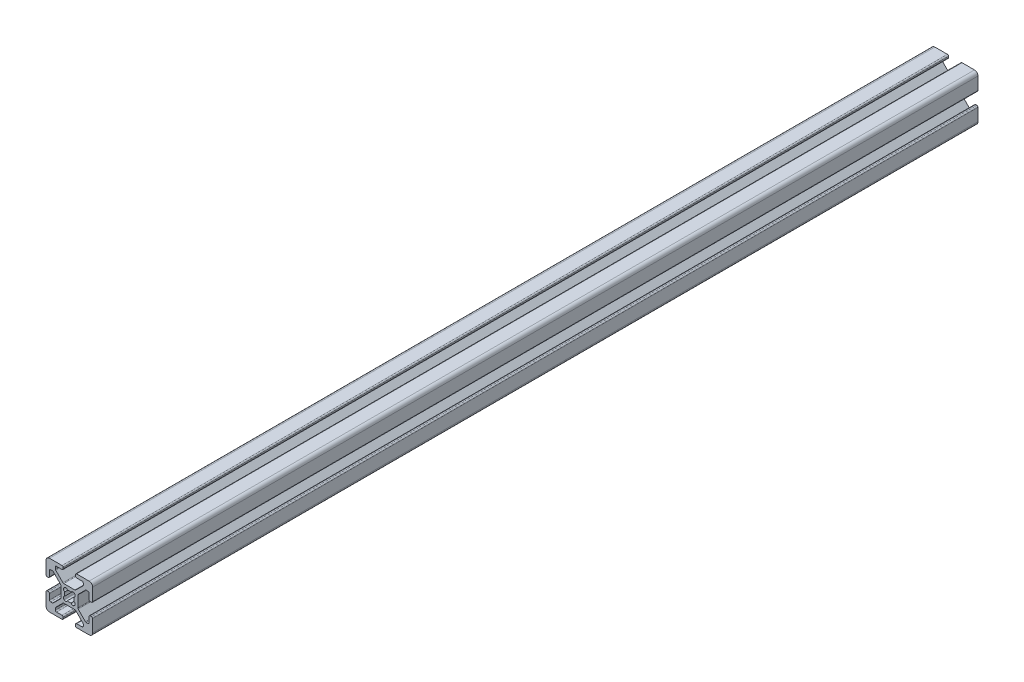
from build123d import *

# Parameters (mm, degrees)
EXTRUDE1_DEPTH      = 330
EXTRUDE1_DEPTH_BACK = 50


with BuildPart() as part:
    # Sketch1 → Extrude1 (new, two sides: drawn at the far end of the back side and taken through both)
    with BuildSketch(Plane.XY.offset(-EXTRUDE1_DEPTH_BACK)):
        with BuildLine():
            Line((-5.032287798, -0.341059771), (-5.516287798, -0.341059771))
            ThreePointArc((-5.516287798, -0.341059771), (-5.875498042, -0.192270016), (-6.024287798, 0.166940229))
            Line((-6.024287798, 0.166940229), (-6.024287798, 2.515940229))
            ThreePointArc((-6.024287798, 2.515940229), (-6.173077553, 2.875150474), (-6.532287798, 3.023940229))
            Line((-6.532287798, 3.023940229), (-7.258207136, 3.023940229))
            ThreePointArc((-7.258207136, 3.023940229), (-7.45261032, 2.985271032), (-7.617417381, 2.875150474))
            Line((-7.617417381, 2.875150474), (-10.720498042, -0.227930187))
            ThreePointArc((-10.720498042, -0.227930187), (-10.8306186, -0.392737249), (-10.869287798, -0.587140432))
            Line((-10.869287798, -0.587140432), (-10.869287798, -5.354979109))
            ThreePointArc((-10.869287798, -5.354979109), (-10.8306186, -5.549382293), (-10.720498042, -5.714189354))
            Line((-10.720498042, -5.714189354), (-7.617417381, -8.817270016))
            ThreePointArc((-7.617417381, -8.817270016), (-7.45261032, -8.927390573), (-7.258207136, -8.966059771))
            Line((-7.258207136, -8.966059771), (-6.532287798, -8.966059771))
            ThreePointArc((-6.532287798, -8.966059771), (-6.173077553, -8.817270016), (-6.024287798, -8.458059771))
            Line((-6.024287798, -8.458059771), (-6.024287798, -6.109059771))
            ThreePointArc((-6.024287798, -6.109059771), (-5.875498042, -5.749849526), (-5.516287798, -5.601059771))
            Line((-5.516287798, -5.601059771), (-5.032287798, -5.601059771))
            ThreePointArc((-5.032287798, -5.601059771), (-4.673077553, -5.749849526), (-4.524287798, -6.109059771))
            Line((-4.524287798, -6.109059771), (-4.524287798, -11.471059771))
            ThreePointArc((-4.524287798, -11.471059771), (-4.963627626, -12.531719943), (-6.024287798, -12.971059771))
            Line((-6.024287798, -12.971059771), (-11.386287798, -12.971059771))
            ThreePointArc((-11.386287798, -12.971059771), (-11.745498042, -12.822270016), (-11.894287798, -12.463059771))
            Line((-11.894287798, -12.463059771), (-11.894287798, -11.979059771))
            ThreePointArc((-11.894287798, -11.979059771), (-11.745498042, -11.619849526), (-11.386287798, -11.471059771))
            Line((-11.386287798, -11.471059771), (-9.037287798, -11.471059771))
            ThreePointArc((-9.037287798, -11.471059771), (-8.678077553, -11.322270016), (-8.529287798, -10.963059771))
            Line((-8.529287798, -10.963059771), (-8.529287798, -10.237140432))
            ThreePointArc((-8.529287798, -10.237140432), (-8.567956995, -10.042737249), (-8.678077553, -9.877930187))
            Line((-8.678077553, -9.877930187), (-11.781158214, -6.774849526))
            ThreePointArc((-11.781158214, -6.774849526), (-11.945965275, -6.664728968), (-12.140368459, -6.626059771))
            Line((-12.140368459, -6.626059771), (-16.908207136, -6.626059771))
            ThreePointArc((-16.908207136, -6.626059771), (-17.10261032, -6.664728968), (-17.267417381, -6.774849526))
            Line((-17.267417381, -6.774849526), (-20.370498042, -9.877930187))
            ThreePointArc((-20.370498042, -9.877930187), (-20.4806186, -10.042737249), (-20.519287798, -10.237140432))
            Line((-20.519287798, -10.237140432), (-20.519287798, -10.963059771))
            ThreePointArc((-20.519287798, -10.963059771), (-20.370498042, -11.322270016), (-20.011287798, -11.471059771))
            Line((-20.011287798, -11.471059771), (-17.662287798, -11.471059771))
            ThreePointArc((-17.662287798, -11.471059771), (-17.303077553, -11.619849526), (-17.154287798, -11.979059771))
            Line((-17.154287798, -11.979059771), (-17.154287798, -12.463059771))
            ThreePointArc((-17.154287798, -12.463059771), (-17.303077553, -12.822270016), (-17.662287798, -12.971059771))
            Line((-17.662287798, -12.971059771), (-23.024287798, -12.971059771))
            ThreePointArc((-23.024287798, -12.971059771), (-24.084947969, -12.531719943), (-24.524287798, -11.471059771))
            Line((-24.524287798, -11.471059771), (-24.524287798, -6.109059771))
            ThreePointArc((-24.524287798, -6.109059771), (-24.375498042, -5.749849526), (-24.016287798, -5.601059771))
            Line((-24.016287798, -5.601059771), (-23.532287798, -5.601059771))
            ThreePointArc((-23.532287798, -5.601059771), (-23.173077553, -5.749849526), (-23.024287798, -6.109059771))
            Line((-23.024287798, -6.109059771), (-23.024287798, -8.458059771))
            ThreePointArc((-23.024287798, -8.458059771), (-22.875498042, -8.817270016), (-22.516287798, -8.966059771))
            Line((-22.516287798, -8.966059771), (-21.790368459, -8.966059771))
            ThreePointArc((-21.790368459, -8.966059771), (-21.595965275, -8.927390573), (-21.431158214, -8.817270016))
            Line((-21.431158214, -8.817270016), (-18.328077553, -5.714189354))
            ThreePointArc((-18.328077553, -5.714189354), (-18.217956995, -5.549382293), (-18.179287798, -5.354979109))
            Line((-18.179287798, -5.354979109), (-18.179287798, -0.587140432))
            ThreePointArc((-18.179287798, -0.587140432), (-18.217956995, -0.392737249), (-18.328077553, -0.227930187))
            Line((-18.328077553, -0.227930187), (-21.431158214, 2.875150474))
            ThreePointArc((-21.431158214, 2.875150474), (-21.595965275, 2.985271032), (-21.790368459, 3.023940229))
            Line((-21.790368459, 3.023940229), (-22.516287798, 3.023940229))
            ThreePointArc((-22.516287798, 3.023940229), (-22.875498042, 2.875150474), (-23.024287798, 2.515940229))
            Line((-23.024287798, 2.515940229), (-23.024287798, 0.166940229))
            ThreePointArc((-23.024287798, 0.166940229), (-23.173077553, -0.192270016), (-23.532287798, -0.341059771))
            Line((-23.532287798, -0.341059771), (-24.016287798, -0.341059771))
            ThreePointArc((-24.016287798, -0.341059771), (-24.375498042, -0.192270016), (-24.524287798, 0.166940229))
            Line((-24.524287798, 0.166940229), (-24.524287798, 5.528940229))
            ThreePointArc((-24.524287798, 5.528940229), (-24.084947969, 6.589600401), (-23.024287798, 7.028940229))
            Line((-23.024287798, 7.028940229), (-17.662287798, 7.028940229))
            ThreePointArc((-17.662287798, 7.028940229), (-17.303077553, 6.880150474), (-17.154287798, 6.520940229))
            Line((-17.154287798, 6.520940229), (-17.154287798, 6.036940229))
            ThreePointArc((-17.154287798, 6.036940229), (-17.303077553, 5.677729984), (-17.662287798, 5.528940229))
            Line((-17.662287798, 5.528940229), (-20.011287798, 5.528940229))
            ThreePointArc((-20.011287798, 5.528940229), (-20.370498042, 5.380150474), (-20.519287798, 5.020940229))
            Line((-20.519287798, 5.020940229), (-20.519287798, 4.295020891))
            ThreePointArc((-20.519287798, 4.295020891), (-20.4806186, 4.100617707), (-20.370498042, 3.935810646))
            Line((-20.370498042, 3.935810646), (-17.267417381, 0.832729984))
            ThreePointArc((-17.267417381, 0.832729984), (-17.10261032, 0.722609427), (-16.908207136, 0.683940229))
            Line((-16.908207136, 0.683940229), (-12.140368459, 0.683940229))
            ThreePointArc((-12.140368459, 0.683940229), (-11.945965275, 0.722609427), (-11.781158214, 0.832729984))
            Line((-11.781158214, 0.832729984), (-8.678077553, 3.935810646))
            ThreePointArc((-8.678077553, 3.935810646), (-8.567956995, 4.100617707), (-8.529287798, 4.295020891))
            Line((-8.529287798, 4.295020891), (-8.529287798, 5.020940229))
            ThreePointArc((-8.529287798, 5.020940229), (-8.678077553, 5.380150474), (-9.037287798, 5.528940229))
            Line((-9.037287798, 5.528940229), (-11.386287798, 5.528940229))
            ThreePointArc((-11.386287798, 5.528940229), (-11.745498042, 5.677729984), (-11.894287798, 6.036940229))
            Line((-11.894287798, 6.036940229), (-11.894287798, 6.520940229))
            ThreePointArc((-11.894287798, 6.520940229), (-11.745498042, 6.880150474), (-11.386287798, 7.028940229))
            Line((-11.386287798, 7.028940229), (-6.024287798, 7.028940229))
            ThreePointArc((-6.024287798, 7.028940229), (-4.963627626, 6.589600401), (-4.524287798, 5.528940229))
            Line((-4.524287798, 5.528940229), (-4.524287798, 0.166940229))
            ThreePointArc((-4.524287798, 0.166940229), (-4.673077553, -0.192270016), (-5.032287798, -0.341059771))
        make_face()
        with BuildLine():
            Line((-12.399386954, -5.275565737), (-12.219781831, -5.095960615))
            ThreePointArc((-12.219781831, -5.095960615), (-12.018349781, -4.327527582), (-12.589154291, -3.775036489))
            ThreePointArc((-12.589154291, -3.775036489), (-12.428787798, -2.971059771), (-12.589154291, -2.167083053))
            ThreePointArc((-12.589154291, -2.167083053), (-12.018349781, -1.61459196), (-12.219781831, -0.846158927))
            Line((-12.219781831, -0.846158927), (-12.399386954, -0.666553805))
            ThreePointArc((-12.399386954, -0.666553805), (-13.167819987, -0.465121754), (-13.72031108, -1.035926265))
            ThreePointArc((-13.72031108, -1.035926265), (-14.524287798, -0.875559771), (-15.328264516, -1.035926265))
            ThreePointArc((-15.328264516, -1.035926265), (-15.880755608, -0.465121754), (-16.649188641, -0.666553805))
            Line((-16.649188641, -0.666553805), (-16.828793764, -0.846158927))
            ThreePointArc((-16.828793764, -0.846158927), (-17.030225814, -1.61459196), (-16.459421304, -2.167083053))
            ThreePointArc((-16.459421304, -2.167083053), (-16.619787798, -2.971059771), (-16.459421304, -3.775036489))
            ThreePointArc((-16.459421304, -3.775036489), (-17.030225814, -4.327527582), (-16.828793764, -5.095960615))
            Line((-16.828793764, -5.095960615), (-16.649188641, -5.275565737))
            ThreePointArc((-16.649188641, -5.275565737), (-15.880755608, -5.476997788), (-15.328264516, -4.906193277))
            ThreePointArc((-15.328264516, -4.906193277), (-14.524287798, -5.066559771), (-13.72031108, -4.906193277))
            ThreePointArc((-13.72031108, -4.906193277), (-13.167819987, -5.476997788), (-12.399386954, -5.275565737))
        make_face(mode=Mode.SUBTRACT)
    extrude(amount=EXTRUDE1_DEPTH + EXTRUDE1_DEPTH_BACK)


solid = part.part
